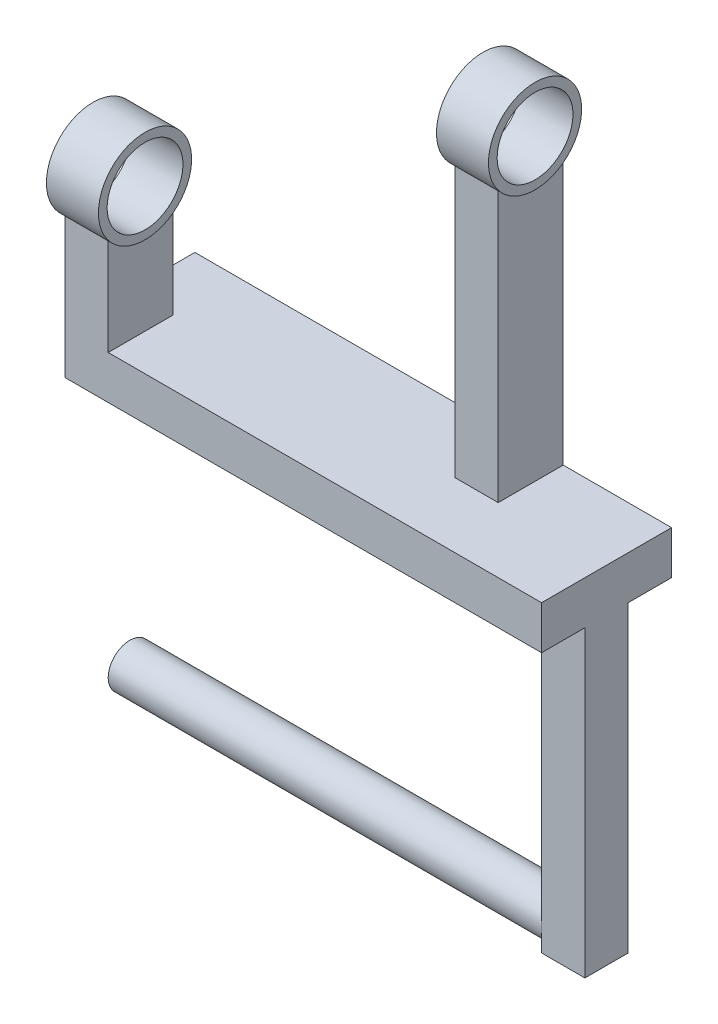
from build123d import *

# Parameters (mm, degrees)
SKETCH2_W            = 110
SKETCH2_H            = 30
BOSS_EXTRUDE2_DEPTH  = 10
SKETCH15_W           = 10
SKETCH15_H           = 15
BOSS_EXTRUDE9_DEPTH  = 30
SKETCH17_R           = 10.75
SKETCH17_R_2         = 8.75
EXTRUDE_THIN3_DEPTH  = 6
SKETCH17_2_R         = 8.75
CUT_EXTRUDE4_DEPTH   = 6
SKETCH19_W           = 10
SKETCH19_H           = 15
BOSS_EXTRUDE11_DEPTH = 70
SKETCH20_R           = 10.75
SKETCH20_R_2         = 8.75
EXTRUDE_THIN4_DEPTH  = 6
SKETCH20_2_R         = 8.75
CUT_EXTRUDE5_DEPTH   = 6
SKETCH21_W           = 10
SKETCH21_H           = 10
BOSS_EXTRUDE12_DEPTH = 70
SKETCH22_R           = 5
BOSS_EXTRUDE13_DEPTH = 100


with BuildPart() as part:
    # Sketch2 → Boss-Extrude2 (new body)
    with BuildSketch(Plane(origin=(0, 0, 0), x_dir=(1, 0, 0), z_dir=(0, 1, 0))):
        with Locations((-5, 0)):
            Rectangle(SKETCH2_W, SKETCH2_H)
    extrude(amount=BOSS_EXTRUDE2_DEPTH)

    # Sketch15 → Boss-Extrude9 (add)
    with BuildSketch(Plane(origin=(0, 10, 0), x_dir=(1, 0, 0), z_dir=(0, 1, 0))):
        with Locations((-55, -7.5)):
            Rectangle(SKETCH15_W, SKETCH15_H)
    extrude(amount=BOSS_EXTRUDE9_DEPTH)

    # Sketch17 → Extrude-Thin3 (add, symmetric)
    with BuildSketch(Plane.ZY.offset(55)):
        with Locations((7.5, 40)):
            Circle(SKETCH17_R)
        with Locations((7.5, 40)):
            Circle(SKETCH17_R_2, mode=Mode.SUBTRACT)
    extrude(amount=EXTRUDE_THIN3_DEPTH, both=True)

    # Sketch17<2> → Cut-Extrude4 (cut, symmetric)
    with BuildSketch(Plane.ZY.offset(55)):
        with Locations((7.5, 40)):
            Circle(SKETCH17_2_R)
    extrude(amount=CUT_EXTRUDE4_DEPTH, both=True, mode=Mode.SUBTRACT)

    # Sketch19 → Boss-Extrude11 (add)
    with BuildSketch(Plane(origin=(0, 10, 0), x_dir=(1, 0, 0), z_dir=(0, 1, 0))):
        with Locations((20, 7.5)):
            Rectangle(SKETCH19_W, SKETCH19_H)
    extrude(amount=BOSS_EXTRUDE11_DEPTH)

    # Sketch20 → Extrude-Thin4 (add, symmetric)
    with BuildSketch(Plane.ZY.offset(-20)):
        with Locations((-7.5, 80)):
            Circle(SKETCH20_R)
        with Locations((-7.5, 80)):
            Circle(SKETCH20_R_2, mode=Mode.SUBTRACT)
    extrude(amount=EXTRUDE_THIN4_DEPTH, both=True)

    # Sketch20<2> → Cut-Extrude5 (cut, symmetric)
    with BuildSketch(Plane.ZY.offset(-20)):
        with Locations((-7.5, 80)):
            Circle(SKETCH20_2_R)
    extrude(amount=CUT_EXTRUDE5_DEPTH, both=True, mode=Mode.SUBTRACT)

    # Sketch21 → Boss-Extrude12 (add)
    with BuildSketch(Plane.XZ):
        with Locations((45, 0)):
            Rectangle(SKETCH21_W, SKETCH21_H)
    extrude(amount=BOSS_EXTRUDE12_DEPTH)

    # Sketch22 → Boss-Extrude13 (add)
    with BuildSketch(Plane.ZY.offset(-40)):
        with Locations((0, -65)):
            Circle(SKETCH22_R)
    extrude(amount=BOSS_EXTRUDE13_DEPTH)


solid = part.part
